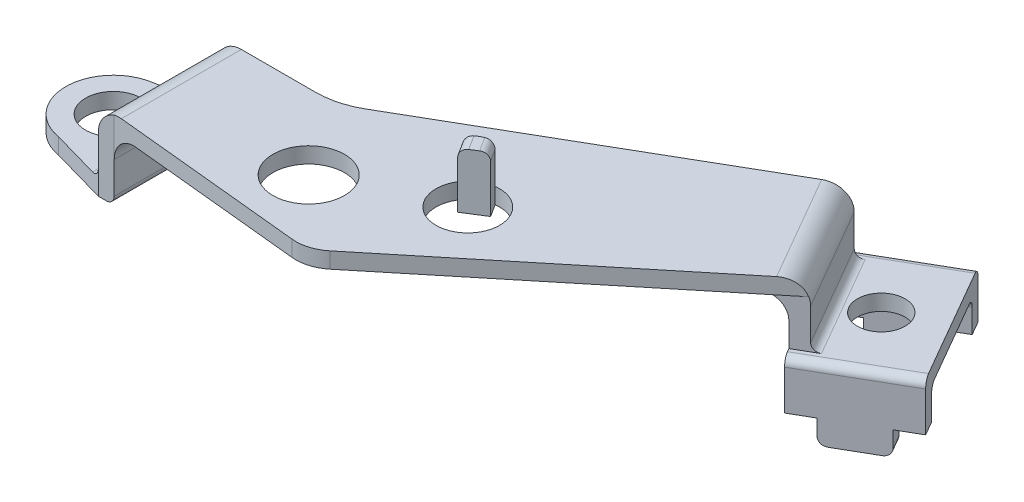
from build123d import *

# Parameters (mm, degrees)
BOSS_EXTRUDE1_DEPTH = 2
SKETCH3_W           = 15
SKETCH3_H           = 8
BOSS_EXTRUDE2_DEPTH = 2
FILLET2_R           = 3
BOSS_EXTRUDE4_DEPTH = 2
FILLET3_R           = 1
BOSS_EXTRUDE5_DEPTH = 2
BOSS_EXTRUDE6_START = -2
BOSS_EXTRUDE6_DEPTH = 2
FILLET5_R           = 1
SKETCH8_W           = 15
SKETCH8_H           = 10
BOSS_EXTRUDE7_DEPTH = 2
FILLET6_R           = 3
SKETCH9_R           = 3.5
BOSS_EXTRUDE8_DEPTH = 2
FILLET7_R           = 1
SKETCH12_R          = 4.5
SKETCH12_R_2        = 4
CUT_EXTRUDE1_DEPTH  = 10
BOSS_EXTRUDE9_DEPTH = 7
FILLET9_R           = 1


with BuildPart() as part:
    # Sketch2 → Boss-Extrude1 (new body)
    with BuildSketch(Plane(origin=(0, 0, 0), x_dir=(1, 0, 0), z_dir=(0, 1, 0))):
        with BuildLine():
            Line((0, 0), (10.320508076, 0))
            ThreePointArc((10.320508076, 0), (12.908698527, 0.340741737), (15.320508076, 1.339745962))
            Line((15.320508076, 1.339745962), (54.291651246, 23.839745962))
            Line((54.291651246, 23.839745962), (61.791651246, 10.849364905))
            Line((61.791651246, 10.849364905), (28.515723989, -16.385037331))
            ThreePointArc((28.515723989, -16.385037331), (26.805291295, -17.296341677), (24.876316463, -17.483722855))
            Line((24.876316463, -17.483722855), (0, -15))
            Line((0, -15), (0, 0))
        make_face()
    extrude(amount=BOSS_EXTRUDE1_DEPTH)

    # Sketch3 → Boss-Extrude2 (add)
    with BuildSketch(Plane(origin=(51.041651246, 0, -29.468911087), x_dir=(-0.5000000000000027, 0, -0.8660254037844372), z_dir=(0.8660254037844372, 0, -0.5000000000000027))):
        with Locations((-14, -4)):
            Rectangle(SKETCH3_W, SKETCH3_H)
    extrude(amount=-BOSS_EXTRUDE2_DEPTH)

    # Fillet2
    # the kernel refuses this fillet: 3 mm, written as the material it adds along each edge
    with BuildSketch(Plane(origin=(52.559600438, 0, -22.839745962), x_dir=(0, -1, 0), z_dir=(0.5000000000000027, 0, 0.8660254037844372))) as fillet2_piece_1:
        with BuildLine():
            CenterArc((FILLET2_R, -FILLET2_R), FILLET2_R, 90, 90)
            Line((0, -FILLET2_R), (0, 0))
            Line((0, 0), (FILLET2_R, 0))
        make_face()
    extrude(amount=15)
    # the kernel refuses this fillet: 3 mm, written as the material it takes off along each edge
    with BuildSketch(Plane(origin=(50.541651246, 2, -30.334936491), x_dir=(-0.866025403784437, 0, 0.5000000000000028), z_dir=(0.5000000000000028, 0, 0.866025403784437))) as fillet2_2_piece_1:
        with BuildLine():
            CenterArc((FILLET2_R, FILLET2_R), FILLET2_R, 180, 90)
            Line((0, FILLET2_R), (0, 0))
            Line((0, 0), (FILLET2_R, 0))
        make_face()
    extrude(amount=30, mode=Mode.SUBTRACT)

    # Sketch5 → Boss-Extrude4 (add)
    with BuildSketch(Plane(origin=(0, -6, 0), x_dir=(-1, 0, 0), z_dir=(0, -1, 0))):
        with BuildLine():
            Line((-63.067930688, 30.638784068), (-67.567930688, 22.844555434))
            Line((-67.567930688, 22.844555434), (-64.536841774, 21.094555434))
            ThreePointArc((-64.536841774, 21.094555434), (-62.715222698, 22.492332913), (-60.438765563, 22.192631645))
            Line((-60.438765563, 22.192631645), (-57.438765563, 27.388784068))
            Line((-57.438765563, 27.388784068), (-63.067930688, 30.638784068))
        make_face()
        with BuildLine():
            Line((-66.438765563, 11.8003268), (-60.809600438, 8.5503268))
            Line((-60.809600438, 8.5503268), (-60.059600438, 9.849364905))
            Line((-60.059600438, 9.849364905), (-52.559600438, 22.839745962))
            Line((-52.559600438, 22.839745962), (-51.809600438, 24.138784068))
            Line((-51.809600438, 24.138784068), (-57.438765563, 27.388784068))
            Line((-57.438765563, 27.388784068), (-60.438765563, 22.192631645))
            ThreePointArc((-60.438765563, 22.192631645), (-59.340689352, 21.094555434), (-58.938765563, 19.594555434))
            ThreePointArc((-58.938765563, 19.594555434), (-60.438765563, 16.996479222), (-63.438765563, 16.996479222))
            Line((-63.438765563, 16.996479222), (-66.438765563, 11.8003268))
        make_face()
        with BuildLine():
            Line((-72.067930688, 15.0503268), (-66.438765563, 11.8003268))
            Line((-66.438765563, 11.8003268), (-63.438765563, 16.996479222))
            ThreePointArc((-63.438765563, 16.996479222), (-64.836543042, 18.818098298), (-64.536841774, 21.094555434))
            Line((-64.536841774, 21.094555434), (-67.567930688, 22.844555434))
            Line((-67.567930688, 22.844555434), (-72.067930688, 15.0503268))
        make_face()
    extrude(amount=BOSS_EXTRUDE4_DEPTH)

    # Fillet3
    fillet3_edges = [part.edges().sort_by_distance(p)[0] for p in [
        (56.309600438, -8, -16.344555434),
        (58.041651246, -6, -17.344555434),
    ]]
    fillet(fillet3_edges, radius=FILLET3_R)

    # Sketch6 → Boss-Extrude5 (add)
    with BuildSketch(Plane(origin=(11.5, 0, 19.918584287), x_dir=(0.8660254037844387, 0, -0.4999999999999999), z_dir=(0.4999999999999999, 0, 0.8660254037844387))):
        with BuildLine():
            ThreePointArc((57.937822174, -8), (57.230715392, -7.707106781), (56.937822174, -7))
            Line((56.937822174, -7), (56.937822174, -12))
            Line((56.937822174, -12), (59.937822174, -12))
            Line((59.937822174, -12), (59.937822174, -14))
            ThreePointArc((59.937822174, -14), (60.230715392, -14.707106781), (60.937822174, -15))
            Line((60.937822174, -15), (65.937822174, -15))
            ThreePointArc((65.937822174, -15), (66.644928955, -14.707106781), (66.937822174, -14))
            Line((66.937822174, -14), (66.937822174, -12))
            Line((66.937822174, -12), (69.937822174, -12))
            Line((69.937822174, -12), (69.937822174, -8))
            Line((69.937822174, -8), (57.937822174, -8))
        make_face()
    extrude(amount=-BOSS_EXTRUDE5_DEPTH)

    # Sketch7 → Boss-Extrude6 (add)
    with BuildSketch(Plane(origin=(2.5, 0, 4.330127019), x_dir=(-0.8660254037844396, 0, 0.49999999999999856), z_dir=(-0.49999999999999856, 0, -0.8660254037844396)).offset(BOSS_EXTRUDE6_START)):
        with BuildLine():
            Line((-65.937822174, -15), (-60.937822174, -15))
            ThreePointArc((-60.937822174, -15), (-60.230715392, -14.707106781), (-59.937822174, -14))
            Line((-59.937822174, -14), (-59.937822174, -12))
            Line((-59.937822174, -12), (-56.937822174, -12))
            Line((-56.937822174, -12), (-56.937822174, -7))
            ThreePointArc((-56.937822174, -7), (-57.230715392, -7.707106781), (-57.937822174, -8))
            Line((-57.937822174, -8), (-69.937822174, -8))
            Line((-69.937822174, -8), (-69.937822174, -12))
            Line((-69.937822174, -12), (-66.937822174, -12))
            Line((-66.937822174, -12), (-66.937822174, -14))
            ThreePointArc((-66.937822174, -14), (-66.644928955, -14.707106781), (-65.937822174, -15))
        make_face()
    extrude(amount=BOSS_EXTRUDE6_DEPTH)

    # Fillet5
    # the kernel refuses this fillet: 1 mm, written as the material it adds along each edge
    with BuildSketch(Plane(origin=(60.675625842, -7, -10.782377607), x_dir=(0, -1, 0), z_dir=(0.8660254037844387, -1.4083318032254873e-14, -0.4999999999999999))) as fillet5_piece_1_section:
        with BuildLine():
            CenterArc((1 + FILLET5_R, FILLET5_R), FILLET5_R, 180, 90)
            Line((1 + FILLET5_R, 0), (1, 0))
            Line((1, 0), (1, FILLET5_R))
        make_face()
    fillet5_piece_1 = revolve(axis=Axis((60.675625842, -7, -10.782377607), (-0.4999999999999999, 0, -0.8660254037844387)), revolution_arc=233.296989237, mode=Mode.PRIVATE)
    fillet5_piece_1 = split(fillet5_piece_1, bisect_by=Plane(origin=(59.653786466, -7.749939066, -10.552255325), z_dir=(0.8660254037844372, 0, -0.5000000000000027)), keep=Keep.TOP, mode=Mode.PRIVATE)
    fillet5_piece_1 = fillet5_piece_1 - Plane(origin=(62.251862677, -5, -12.052255325), x_dir=(-0.866025403784437, 0, 0.5000000000000028), z_dir=(-0.5000000000000028, 0, -0.866025403784437)) * Cylinder(1, 9, mode=Mode.PRIVATE)
    add(fillet5_piece_1)
    with BuildSketch(Plane(origin=(71.067930688, -8, -16.782377607), x_dir=(-0.4999999999999999, -3.552713678800505e-15, -0.8660254037844387), z_dir=(-0.8660254037844387, 0, 0.4999999999999999)), Plane(origin=(53.675625842, -8, -22.90673326), x_dir=(0.49999999999999856, -1.776356839400247e-15, 0.8660254037844395), z_dir=(0.8660254037844396, 0, -0.49999999999999856))) as fillet5_piece_2:
        with BuildLine():
            CenterArc((FILLET5_R, FILLET5_R), FILLET5_R, 180, 90)
            Line((0, FILLET5_R), (0, 0))
            Line((0, 0), (FILLET5_R, 0))
        make_face()
    extrude(amount=12)
    with BuildSketch(Plane(origin=(53.675625842, -7, -22.90673326), x_dir=(0.6943308785696991, 0.5976672776326631, -0.40087211964888625), z_dir=(0.5175950454405738, -0.8017442392977709, -0.29883363881633085))) as fillet5_piece_3_section:
        with BuildLine():
            CenterArc((1 + FILLET5_R, FILLET5_R), FILLET5_R, 180, 90)
            Line((1, FILLET5_R), (1, 0))
            Line((1, 0), (1 + FILLET5_R, 0))
        make_face()
    fillet5_piece_3 = revolve(axis=Axis((53.675625842, -7, -22.90673326), (0.49999999999999856, 0, 0.8660254037844396)), revolution_arc=233.296989237, mode=Mode.PRIVATE)
    fillet5_piece_3 = split(fillet5_piece_3, bisect_by=Plane(origin=(52.965414583, -7.749938757, -22.136855245), z_dir=(0.8660254037844372, 0, -0.5000000000000027)), keep=Keep.TOP, mode=Mode.PRIVATE)
    fillet5_piece_3 = fillet5_piece_3 - Plane(origin=(55.563490794, -5, -23.636855245), x_dir=(-0.866025403784437, 0, 0.5000000000000028), z_dir=(-0.5000000000000028, 0, -0.866025403784437)) * Cylinder(1, 9, mode=Mode.PRIVATE)
    add(fillet5_piece_3)
    # the kernel refuses this fillet: 1 mm, written as the material it takes off along each edge
    with BuildSketch(Plane(origin=(58.644536929, -6, -7.3003268), x_dir=(-0.4999999999999999, 0, -0.8660254037844388), z_dir=(0.8660254037844388, 0, -0.4999999999999999))) as fillet5_2_piece_1:
        with BuildLine():
            CenterArc((FILLET5_R, -FILLET5_R), FILLET5_R, 90, 90)
            Line((0, -FILLET5_R), (0, 0))
            Line((0, 0), (FILLET5_R, 0))
        make_face()
    extrude(amount=18, mode=Mode.SUBTRACT)
    with BuildSketch(Plane(origin=(49.644536929, -6, -22.888784068), x_dir=(0.49999999999999833, 0, 0.8660254037844396), z_dir=(0.8660254037844396, 0, -0.4999999999999983))) as fillet5_2_piece_2:
        with BuildLine():
            CenterArc((FILLET5_R, FILLET5_R), FILLET5_R, 180, 90)
            Line((0, FILLET5_R), (0, 0))
            Line((0, 0), (FILLET5_R, 0))
        make_face()
    extrude(amount=18, mode=Mode.SUBTRACT)

    # Sketch8 → Boss-Extrude7 (add)
    with BuildSketch(Plane.ZY):
        with Locations((7.5, -3)):
            Rectangle(SKETCH8_W, SKETCH8_H)
    extrude(amount=BOSS_EXTRUDE7_DEPTH)

    # Fillet6
    fillet6_edges = [part.edges().sort_by_distance(p)[0] for p in [
        (0, 0, 7.5),
        (-2, 2, 7.5),
    ]]
    fillet(fillet6_edges, radius=FILLET6_R)

    # Sketch9 → Boss-Extrude8 (add)
    with BuildSketch(Plane.XZ.offset(8)):
        with BuildLine():
            Line((-2, 0), (-9, 1.183215957))
            ThreePointArc((-9, 1.183215957), (-14, 7.09929574), (-9, 13.015375523))
            Line((-9, 13.015375523), (-2, 15))
            Line((-2, 15), (-2, 0))
        make_face()
        with Locations(Location((-8, 7.09929574, 0), (0, 0, 270))):
            Circle(SKETCH9_R, mode=Mode.SUBTRACT)
    extrude(amount=-BOSS_EXTRUDE8_DEPTH)

    # Fillet7
    fillet7_edges = [part.edges().sort_by_distance(p)[0] for p in [
        (-2, -6, 7.5),
        (0, -8, 7.5),
    ]]
    fillet(fillet7_edges, radius=FILLET7_R)

    # Sketch12 → Cut-Extrude1 (cut)
    with BuildSketch(Plane(origin=(0, 2, 0), x_dir=(1, 0, 0), z_dir=(0, 1, 0))):
        with Locations(Location((18.910947854, -9.438044762, 0), (0, 0, 270))):
            Circle(SKETCH12_R)
        with Locations(Location((32.42399256, -2.926699067, 0), (0, 0, 270))):
            Circle(SKETCH12_R_2)
    extrude(amount=-CUT_EXTRUDE1_DEPTH, mode=Mode.SUBTRACT)


with BuildPart() as body_2:
    # Sketch11 → Boss-Extrude9 (new body)
    with BuildSketch(Plane.XZ):
        with BuildLine():
            Line((29.29079596, 0.440119275), (30.359652266, 2.13054709))
            Line((30.359652266, 2.13054709), (32.895293988, 0.527262631))
            Line((32.895293988, 0.527262631), (31.904665791, -1.039445119))
            ThreePointArc((31.904665791, -1.039445119), (30.484006019, -0.500574739), (29.29079596, 0.440119275))
        make_face()
    extrude(amount=-BOSS_EXTRUDE9_DEPTH)

    # Fillet9
    fillet9_edges = [body_2.edges().sort_by_distance(p)[0] for p in [
        (29.825224113, 7, 1.285333183),
        (32.399979889, 7, -0.256091244),
    ]]
    fillet(fillet9_edges, radius=FILLET9_R)


solid = Compound([part.part, body_2.part])
